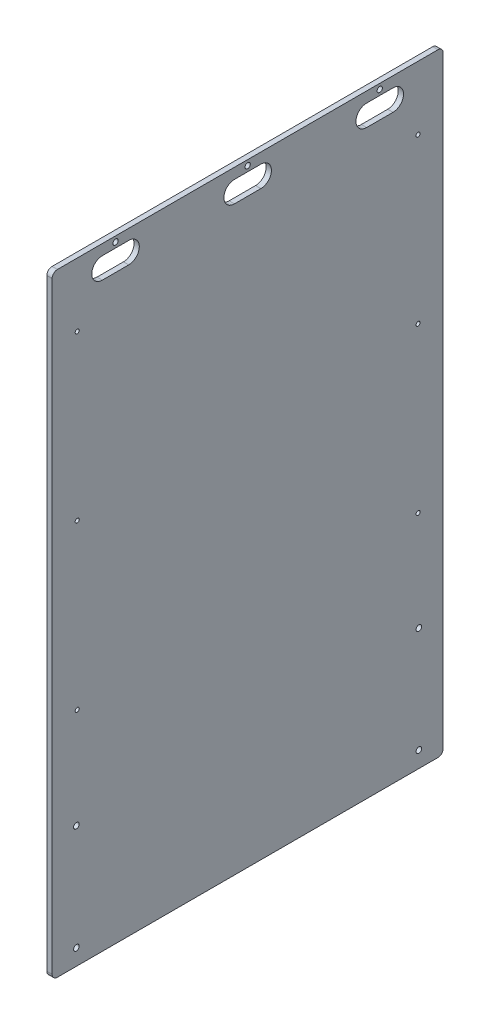
from build123d import *

# Parameters (mm, degrees)
SKETCH1_W                    = 469.9
SKETCH1_H                    = 736.6
BOSS_EXTRUDE1_DEPTH          = 6.35
F_10_0_1935_DIAMETER_HOLE1_D = 4.9149
H_0_266_DIAMETER_HOLE1_D     = 6.7564
CUT_EXTRUDE1_DEPTH           = 437.905842259
FILLET1_R                    = 6.35
E_0_25_DIAMETER_HOLE1_D      = 6.35


with BuildPart() as part:
    # Sketch1 → Boss-Extrude1 (new body)
    with BuildSketch(Plane(origin=(0, 0, 0), x_dir=(0, 0, -1), z_dir=(1, 0, 0))):
        Rectangle(SKETCH1_W, SKETCH1_H)
    extrude(amount=BOSS_EXTRUDE1_DEPTH)

    # #10 (0.1935) Diameter Hole1 (through all)
    with Locations(Plane(origin=(6.35, 0, 0), x_dir=(0, 0, -1), z_dir=(1, 0, 0))):
        with Locations((-204.7875, 291.846), (-204.7875, 94.996), (-204.7875, -101.854), (204.7875, 94.996), (204.7875, 291.846), (204.7875, -101.854)):
            Hole(F_10_0_1935_DIAMETER_HOLE1_D / 2)

    # H (0.266) Diameter Hole1 (through all)
    with Locations(Plane(origin=(6.35, 0, 0), x_dir=(0, 0, -1), z_dir=(1, 0, 0))):
        with Locations((-205.74, -221.996), (-205.74, -348.996), (205.74, -221.996), (205.74, -348.996)):
            Hole(H_0_266_DIAMETER_HOLE1_D / 2)

    # Sketch7 → Cut-Extrude1 (cut, through all)
    with BuildSketch(Plane(origin=(6.35, 0, 0), x_dir=(0, 0, -1), z_dir=(1, 0, 0))):
        with BuildLine():
            Line((-174.625, 355.6), (-142.875, 355.6))
            ThreePointArc((-142.875, 355.6), (-130.175, 342.9), (-142.875, 330.2))
            Line((-142.875, 330.2), (-174.625, 330.2))
            ThreePointArc((-174.625, 330.2), (-187.325, 342.9), (-174.625, 355.6))
        make_face()
        with BuildLine():
            Line((-15.875, 355.6), (15.875, 355.6))
            ThreePointArc((15.875, 355.6), (28.575, 342.9), (15.875, 330.2))
            Line((15.875, 330.2), (-15.875, 330.2))
            ThreePointArc((-15.875, 330.2), (-28.575, 342.9), (-15.875, 355.6))
        make_face()
        with BuildLine():
            Line((142.875, 355.6), (174.625, 355.6))
            ThreePointArc((174.625, 355.6), (187.325, 342.9), (174.625, 330.2))
            Line((174.625, 330.2), (142.875, 330.2))
            ThreePointArc((142.875, 330.2), (130.175, 342.9), (142.875, 355.6))
        make_face()
    extrude(amount=-CUT_EXTRUDE1_DEPTH, mode=Mode.SUBTRACT)

    # Fillet1
    fillet1_edges = [part.edges().sort_by_distance(p)[0] for p in [
        (3.175, -368.3, -234.95),
        (3.175, -368.3, 234.95),
        (3.175, 368.3, 234.95),
        (3.175, 368.3, -234.95),
    ]]
    fillet(fillet1_edges, radius=FILLET1_R)

    # E (0.25) Diameter Hole1 (through all)
    with Locations(Plane(origin=(6.35, 0, 0), x_dir=(0, 0, -1), z_dir=(1, 0, 0))):
        with Locations((-158.75, 361.95), (0, 361.95), (158.75, 361.95)):
            Hole(E_0_25_DIAMETER_HOLE1_D / 2)


solid = part.part
